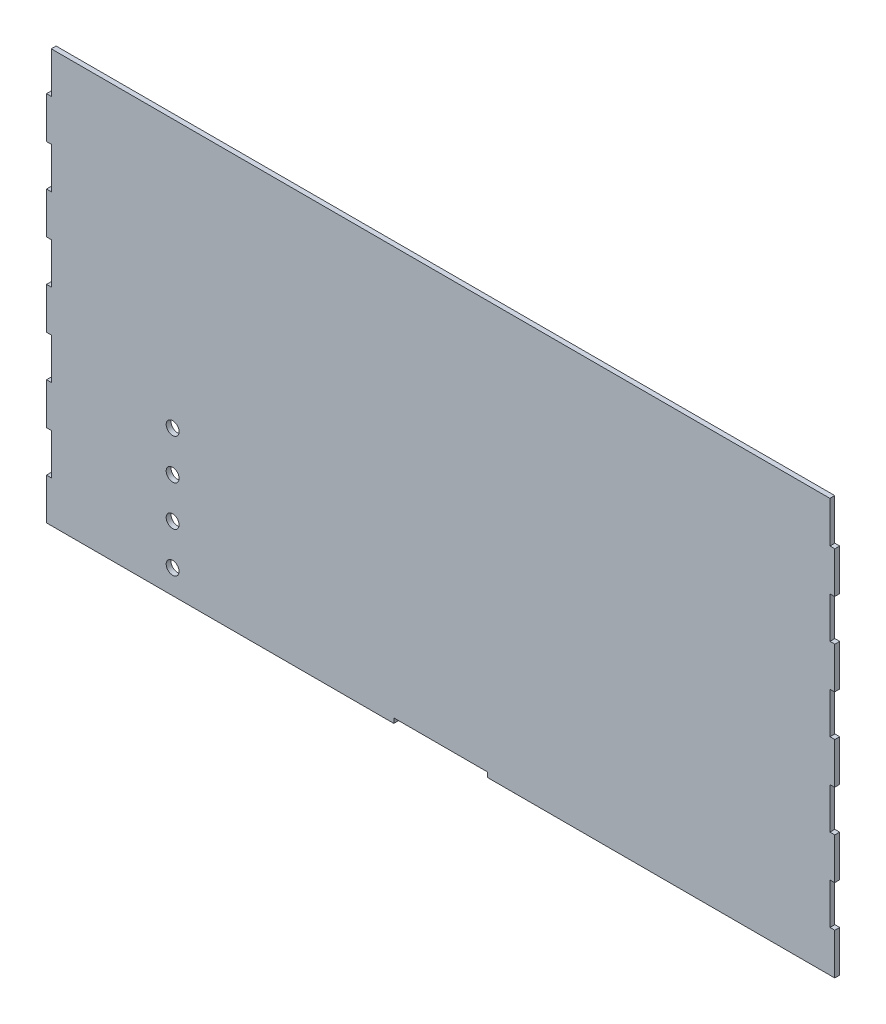
from build123d import *

# Parameters (mm, degrees)
SKETCH1_W           = 977.375
SKETCH1_H           = 512
BOSS_EXTRUDE1_DEPTH = 6
CUT_EXTRUDE3_DEPTH  = 10
LPATTERN1_COUNT     = 5
LPATTERN1_PITCH     = 102.4
SKETCH8_W           = 6
SKETCH8_H           = 0.580661117
CUT_EXTRUDE4_DEPTH  = 10
CUT_EXTRUDE5_DEPTH  = 10
LPATTERN4_COUNT     = 5
LPATTERN4_PITCH     = 102.4
SKETCH11_W          = 6
SKETCH11_H          = 0.733192148
CUT_EXTRUDE6_DEPTH  = 10
SKETCH14_W          = 116
SKETCH14_H          = 6
CUT_EXTRUDE9_DEPTH  = 10
SKETCH15_R          = 8
CUT_EXTRUDE11_DEPTH = 10
LPATTERN5_COUNT     = 4
LPATTERN5_PITCH     = 50


with BuildPart() as part:
    # Sketch1 → Boss-Extrude1 (new body)
    with BuildSketch(Plane.XY):
        Rectangle(SKETCH1_W, SKETCH1_H)
    extrude(amount=BOSS_EXTRUDE1_DEPTH)

    # Sketch7 → Cut-Extrude3 (cut)
    with BuildSketch(Plane.XY.offset(6)):
        with BuildLine():
            add(Edge.make_bspline(
                [(488.6875, -204.8), (488.6875, -204.6), (485.6875, -204.6), (482.6875, -204.6), (482.6875, -204.8)],
                knots=[0, 0, 0, 1.570796327, 1.570796327, 3.141592654, 3.141592654, 3.141592654], degree=2, weights=[1, 0.707106781, 1, 0.707106781, 1]))
            Line((488.6875, -204.8), (488.6875, -153.6))
            add(Edge.make_bspline(
                [(482.6875, -153.6), (482.6875, -153.8), (485.6875, -153.8), (488.6875, -153.8), (488.6875, -153.6)],
                knots=[3.141592654, 3.141592654, 3.141592654, 4.71238898, 4.71238898, 6.283185307, 6.283185307, 6.283185307], degree=2, weights=[1, 0.707106781, 1, 0.707106781, 1]))
            Line((482.6875, -153.6), (482.6875, -204.8))
        make_face()
    cut_extrude3 = extrude(amount=-CUT_EXTRUDE3_DEPTH, mode=Mode.SUBTRACT)

    # LPattern1: Cut-Extrude3 ×5
    with Locations(*[(0, i * LPATTERN1_PITCH, 0) for i in range(1, LPATTERN1_COUNT)]):
        add(cut_extrude3, mode=Mode.SUBTRACT)

    # Sketch8 → Cut-Extrude4 (cut)
    with BuildSketch(Plane.XY.offset(6)):
        with Locations((485.6875, 255.709669442)):
            Rectangle(SKETCH8_W, SKETCH8_H)
    extrude(amount=-CUT_EXTRUDE4_DEPTH, mode=Mode.SUBTRACT)

    # Sketch10 → Cut-Extrude5 (cut)
    with BuildSketch(Plane.XY.offset(6)):
        with BuildLine():
            Line((-488.6875, -153.6), (-488.6875, -204.8))
            add(Edge.make_bspline(
                [(-482.6875, -204.8), (-482.6875, -204.6), (-485.6875, -204.6), (-488.6875, -204.6), (-488.6875, -204.8)],
                knots=[0, 0, 0, 1.570796327, 1.570796327, 3.141592654, 3.141592654, 3.141592654], degree=2, weights=[1, 0.707106781, 1, 0.707106781, 1]))
            Line((-482.6875, -204.8), (-482.6875, -153.6))
            add(Edge.make_bspline(
                [(-488.6875, -153.6), (-488.6875, -153.8), (-485.6875, -153.8), (-482.6875, -153.8), (-482.6875, -153.6)],
                knots=[3.141592654, 3.141592654, 3.141592654, 4.71238898, 4.71238898, 6.283185307, 6.283185307, 6.283185307], degree=2, weights=[1, 0.707106781, 1, 0.707106781, 1]))
        make_face()
    cut_extrude5 = extrude(amount=-CUT_EXTRUDE5_DEPTH, mode=Mode.SUBTRACT)

    # LPattern4: Cut-Extrude5 ×5
    with Locations(*[(0, i * LPATTERN4_PITCH, 0) for i in range(1, LPATTERN4_COUNT)]):
        add(cut_extrude5, mode=Mode.SUBTRACT)

    # Sketch11 → Cut-Extrude6 (cut)
    with BuildSketch(Plane.XY.offset(6)):
        with Locations((-485.6875, 255.633403926)):
            Rectangle(SKETCH11_W, SKETCH11_H)
    extrude(amount=-CUT_EXTRUDE6_DEPTH, mode=Mode.SUBTRACT)

    # Sketch14 → Cut-Extrude9 (cut)
    with BuildSketch(Plane.XY.offset(6)):
        with Locations((0, -253.030374654)):
            Rectangle(SKETCH14_W, SKETCH14_H)
    extrude(amount=-CUT_EXTRUDE9_DEPTH, mode=Mode.SUBTRACT)

    # Sketch15 → Cut-Extrude11 (cut)
    with BuildSketch(Plane.XY.offset(6)):
        with Locations((-332.1875, -226)):
            Circle(SKETCH15_R)
    cut_extrude11 = extrude(amount=-CUT_EXTRUDE11_DEPTH, mode=Mode.SUBTRACT)

    # LPattern5: Cut-Extrude11 ×4
    with Locations(*[(0, i * LPATTERN5_PITCH, 0) for i in range(1, LPATTERN5_COUNT)]):
        add(cut_extrude11, mode=Mode.SUBTRACT)


solid = part.part
